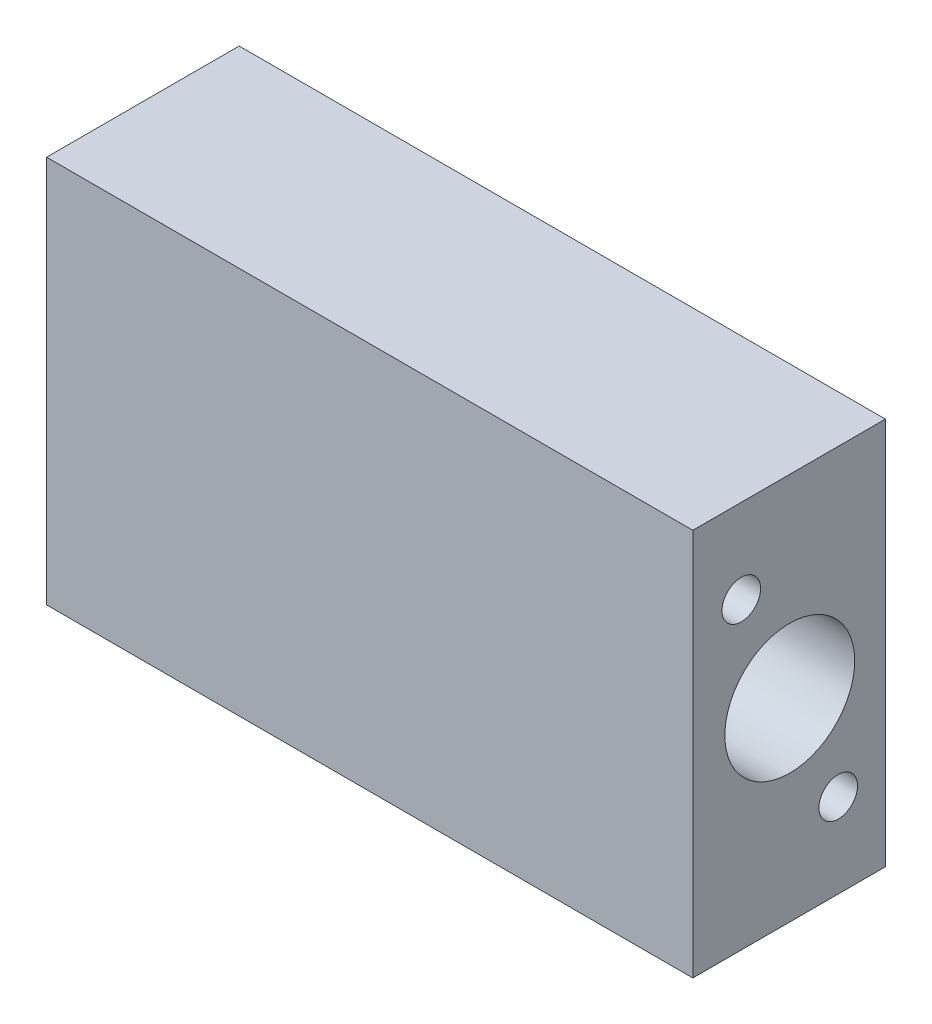
from build123d import *

# Parameters (mm, degrees)
SKETCH1_W                         = 63.5
SKETCH1_H                         = 38.1
BOSS_EXTRUDE1_DEPTH               = 19.05
F_1_2_0_5025_DIAMETER_HOLE1_D     = 12.7635
F_1_2_0_5025_DIAMETER_HOLE1_DEPTH = 57.144535069
F_1_2_0_5025_DIAMETER_HOLE1_TIP   = 3.834542255
F_35_0_11_DIAMETER_HOLE1_D        = 2.794
F_35_0_11_DIAMETER_HOLE1_DEPTH    = 9.652
F_35_0_11_DIAMETER_HOLE1_TIP      = 0.839402285
F_10_24_TAPPED_HOLE1_D            = 3.7973
F_10_24_TAPPED_HOLE1_DEPTH        = 10.035175986
F_10_24_TAPPED_HOLE1_TIP          = 1.140824014
SKETCH9_R                         = 4.7498
BOSS_EXTRUDE2_DEPTH               = 6.35
F_10_24_TAPPED_HOLE2_D            = 3.7973
F_10_24_TAPPED_HOLE2_DEPTH        = 10.414
F_10_24_TAPPED_HOLE2_CSINK_D      = 5.08
F_10_24_TAPPED_HOLE2_CSINK_ANGLE  = 90
F_10_24_TAPPED_HOLE2_TIP          = 1.140824014
CHAMFER1_SIZE                     = 0.127


with BuildPart() as part:
    # Sketch1 → Boss-Extrude1 (new body)
    with BuildSketch(Plane.XY):
        with Locations((-5.976242834, 24.252126053)):
            Rectangle(SKETCH1_W, SKETCH1_H)
    extrude(amount=BOSS_EXTRUDE1_DEPTH)

    # 1/2 (0.5025) Diameter Hole1
    with Locations(Plane(origin=(25.773757166, 0, 0), x_dir=(0, 0, -1), z_dir=(1, 0, 0))):
        with Locations((-9.525, 24.252126053)):
            Hole(F_1_2_0_5025_DIAMETER_HOLE1_D / 2, depth=F_1_2_0_5025_DIAMETER_HOLE1_DEPTH)
            with Locations((0, 0, -(F_1_2_0_5025_DIAMETER_HOLE1_DEPTH + F_1_2_0_5025_DIAMETER_HOLE1_TIP / 2))):  # 118° drill point
                Cone(0, F_1_2_0_5025_DIAMETER_HOLE1_D / 2, F_1_2_0_5025_DIAMETER_HOLE1_TIP, mode=Mode.SUBTRACT)

    # #35 (0.11) Diameter Hole1
    with Locations(Plane(origin=(0, 0, 0), x_dir=(-1, 0, 0), z_dir=(0, 0, -1))):
        with Locations((26.250138314, 20.873926053), (26.250138314, 27.630326053), (-14.435604522, 27.630326053), (-14.435604522, 20.873926053)):
            Hole(F_35_0_11_DIAMETER_HOLE1_D / 2, depth=F_35_0_11_DIAMETER_HOLE1_DEPTH)
            with Locations((0, 0, -(F_35_0_11_DIAMETER_HOLE1_DEPTH + F_35_0_11_DIAMETER_HOLE1_TIP / 2))):  # 118° drill point
                Cone(0, F_35_0_11_DIAMETER_HOLE1_D / 2, F_35_0_11_DIAMETER_HOLE1_TIP, mode=Mode.SUBTRACT)

    # #10-24 Tapped Hole1
    with Locations(Plane(origin=(25.773757166, 0, 0), x_dir=(0, 0, -1), z_dir=(1, 0, 0))):
        with Locations((-4.7625, 13.478578619), (-14.2875, 35.025673487)):
            Hole(F_10_24_TAPPED_HOLE1_D / 2, depth=F_10_24_TAPPED_HOLE1_DEPTH)
            with Locations((0, 0, -(F_10_24_TAPPED_HOLE1_DEPTH + F_10_24_TAPPED_HOLE1_TIP / 2))):  # 118° drill point
                Cone(0, F_10_24_TAPPED_HOLE1_D / 2, F_10_24_TAPPED_HOLE1_TIP, mode=Mode.SUBTRACT)

    # Sketch9 → Boss-Extrude2 (add)
    with BuildSketch(Plane(origin=(0, 0, 0), x_dir=(-1, 0, 0), z_dir=(0, 0, -1))):
        with Locations((10.738742834, 24.252126053)):
            Circle(SKETCH9_R)
    extrude(amount=BOSS_EXTRUDE2_DEPTH)

    # #10-24 Tapped Hole2
    with Locations(Plane(origin=(0, 0, -6.35), x_dir=(-1, 0, 0), z_dir=(0, 0, -1))):
        with Locations((10.738742834, 24.252126053)):
            CounterSinkHole(F_10_24_TAPPED_HOLE2_D / 2, F_10_24_TAPPED_HOLE2_CSINK_D / 2, depth=F_10_24_TAPPED_HOLE2_DEPTH, counter_sink_angle=F_10_24_TAPPED_HOLE2_CSINK_ANGLE)
            with Locations((0, 0, -(F_10_24_TAPPED_HOLE2_DEPTH + F_10_24_TAPPED_HOLE2_TIP / 2))):  # 118° drill point
                Cone(0, F_10_24_TAPPED_HOLE2_D / 2, F_10_24_TAPPED_HOLE2_TIP, mode=Mode.SUBTRACT)

    # Chamfer1
    chamfer1_edges = [part.edges().sort_by_distance(p)[0] for p in [
        (-5.976242834, 43.302126053, 0),
        (25.773757166, 24.252126053, 0),
        (-5.976242834, 5.202126053, 0),
        (-37.726242834, 24.252126053, 0),
        (-5.988942834, 24.252126053, -6.35),
        (13.038604522, 20.873926053, 0),
        (13.038604522, 27.630326053, 0),
        (-27.647138314, 20.873926053, 0),
        (-27.647138314, 27.630326053, 0),
    ]]
    chamfer(chamfer1_edges, length=CHAMFER1_SIZE)


solid = part.part
